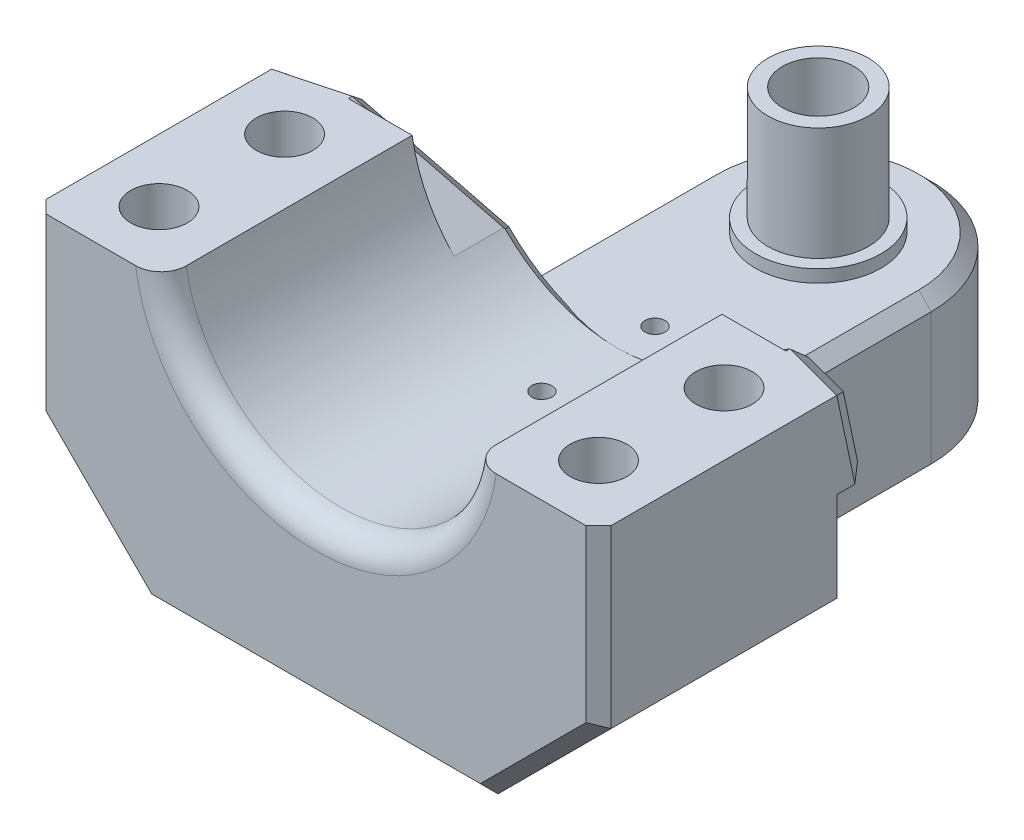
from build123d import *

# Parameters (mm, degrees)
SKETCH1_R               = 2.25
SKETCH1_R_2             = 2.75
BOSS_EXTRUDE1_DEPTH     = 23
CUT_EXTRUDE1_DEPTH      = 10
CUT_EXTRUDE1_DEPTH_BACK = 51.55937104
SKETCH2_R               = 12.5
BOSS_EXTRUDE2_START     = -22.5
BOSS_EXTRUDE2_DEPTH     = 5
CUT_EXTRUDE8_REACH      = 52.496
FILLET1_R               = 2
CHAMFER1_SIZE           = 9
CHAMFER2_SIZE           = 1
SKETCH5_R               = 3.35
CUT_EXTRUDE10_DEPTH     = 4
CUT_EXTRUDE11_START     = -15
SKETCH6_W               = 18
SKETCH6_H               = 3.825324214
CUT_EXTRUDE11_DEPTH     = 36.559371208
CHAMFER3_SIZE           = 1
CHAMFER4_SIZE           = 1
CHAMFER5_SIZE           = 1
CHAMFER6_SIZE           = 1
SKETCH7_R               = 4
SKETCH7_R_2             = 2.85
BOSS_EXTRUDE3_DEPTH     = 10
SKETCH8_R               = 5
SKETCH8_R_2             = 4
EXTRUDE_THIN1_DEPTH     = 1
SKETCH10_R              = 0.3
BOSS_EXTRUDE4_DEPTH     = 4
BOSS_EXTRUDE5_START     = 4
SKETCH11_R              = 2.5
SKETCH11_R_2            = 1.6
BOSS_EXTRUDE5_DEPTH     = 2
SKETCH13_R              = 1.6
SKETCH13_R_2            = 0.8
CUT_EXTRUDE13_DEPTH     = 7
BOSS_EXTRUDE6_START     = 2
BOSS_EXTRUDE6_DEPTH     = 2
CUT_EXTRUDE14_REACH     = 52.559
SKETCH13_2_R            = 0.8
CHAMFER8_SIZE           = 1
CHAMFER8_SIZE2          = 1.732050808
CHAMFER9_SIZE           = 1
CHAMFER9_SIZE2          = 1.732050808
CUT_EXTRUDE15_DEPTH     = 15


with BuildPart() as part:
    # Sketch1 → Boss-Extrude1 (new body)
    with BuildSketch(Plane(origin=(0, 0, 0), x_dir=(1, 0, 0), z_dir=(0, 1, 0))):
        with BuildLine():
            Line((-22.5, -10), (-22.5, 10))
            Line((-22.5, 10), (-9, 10))
            Line((-9, 10), (-9, 30))
            ThreePointArc((-9, 30), (0, 39), (9, 30))
            Line((9, 30), (9, 10))
            Line((9, 10), (22.5, 10))
            Line((22.5, 10), (22.5, -10))
            Line((22.5, -10), (-22.5, -10))
        make_face()
        with Locations(Location((-17.5, 5, 0), (0, 0, 270))):
            Circle(SKETCH1_R, mode=Mode.SUBTRACT)
        with Locations(Location((-17.5, -5, 0), (0, 0, 270))):
            Circle(SKETCH1_R, mode=Mode.SUBTRACT)
        with Locations(Location((17.5, 5, 0), (0, 0, 270))):
            Circle(SKETCH1_R, mode=Mode.SUBTRACT)
        with Locations(Location((17.5, -5, 0), (0, 0, 270))):
            Circle(SKETCH1_R, mode=Mode.SUBTRACT)
        with Locations(Location((0, 30, 0), (0, 0, 270))):
            Circle(SKETCH1_R_2, mode=Mode.SUBTRACT)
    extrude(amount=BOSS_EXTRUDE1_DEPTH)

    # Sketch2 → Cut-Extrude1 (cut, two sides: drawn at the far end of the back side and taken through both)
    with BuildSketch(Plane.XY.offset(-CUT_EXTRUDE1_DEPTH_BACK)):
        with Locations((0, 25)):
            Circle(SKETCH2_R)
    extrude(amount=CUT_EXTRUDE1_DEPTH + CUT_EXTRUDE1_DEPTH_BACK, mode=Mode.SUBTRACT)

    # Sketch3 → Boss-Extrude2 (add)
    with BuildSketch(Plane(origin=(0, 0, -32.5), x_dir=(-1, 0, 0), z_dir=(0, 0, -1)).offset(BOSS_EXTRUDE2_START)):
        Polygon((9, 16.325324214), (17.41948134, 23), (22.5, 23), (22.5, 16.146397564), (9, 5.444060985), align=None)
    boss_extrude2 = extrude(amount=BOSS_EXTRUDE2_DEPTH)

    # Mirror1: Boss-Extrude2 across plane
    add(boss_extrude2.mirror(Plane(origin=(0, 0, 0), x_dir=(0, 0, 1), z_dir=(1, 0, 0))))

    # Sketch4 → Cut-Extrude8 (cut, up to next)
    with BuildSketch(Plane(origin=(4.474031923, 5.643574234, 0), x_dir=(0.7836265295847679, -0.6212322127280048, 0), z_dir=(0.6212322127280048, 0.7836265295847679, 0)), mode=Mode.PRIVATE) as cut_extrude8_sk1:
        Polygon((-17.194456051, 15), (-31.919937808, 10), (-31.919937808, 15.796390808), (-17.194456051, 15.796390808), align=None)
    cut_extrude8_tool1 = extrude(cut_extrude8_sk1.sketch, amount=-CUT_EXTRUDE8_REACH, mode=Mode.PRIVATE) & part.part
    cut_extrude8 = cut_extrude8_tool1.solids().sort_by_distance((-16.228214, 22.055604, -13.832193))[0]
    add(cut_extrude8, mode=Mode.SUBTRACT)

    # Mirror2: Cut-Extrude8 across plane
    add(cut_extrude8.mirror(Plane(origin=(0, 0, 0), x_dir=(0, 0, 1), z_dir=(1, 0, 0))), mode=Mode.SUBTRACT)

    # Fillet1
    fillet1_edges = [part.edges().sort_by_distance(p)[0] for p in [
        (0, 12.5, 10),
    ]]
    fillet(fillet1_edges, radius=FILLET1_R)

    # Chamfer1
    # the kernel refuses this chamfer: 9 mm, written as the material it takes off along each edge
    with BuildSketch(Plane(origin=(22.5, 0, -33.145146892), x_dir=(-0.9996219169112966, -0.027495876610586365, 0), z_dir=(0, 0, 1))) as chamfer1_piece_1:
        Polygon((CHAMFER1_SIZE * 0.999621916911, -CHAMFER1_SIZE * 0.0274958766106), (-CHAMFER1_SIZE * 0.0274958766106, -CHAMFER1_SIZE * 0.999621916911), (0, 0), align=None)
    extrude(amount=66.290293783, mode=Mode.SUBTRACT)
    with BuildSketch(Plane(origin=(-22.5, 0, 33.145146892), x_dir=(-0.02749587661058639, 0.9996219169112966, 0), z_dir=(0, 0, -1))) as chamfer1_piece_2:
        Polygon((CHAMFER1_SIZE * 0.999621916911, CHAMFER1_SIZE * 0.0274958766106), (-CHAMFER1_SIZE * 0.0274958766106, CHAMFER1_SIZE * 0.999621916911), (0, 0), align=None)
    extrude(amount=66.290293783, mode=Mode.SUBTRACT)

    # Chamfer2
    chamfer2_edges = [part.edges().sort_by_distance(p)[0] for p in [
        (-11.25, 0, -10),
        (11.25, 0, -10),
        (18, 4.5, -10),
        (0, 0, 10),
        (-18, 4.5, 10),
        (18, 4.5, 10),
        (-18, 4.5, -10),
        (22.5, 16, 10),
        (-22.5, 16, 10),
        (-22.5, 12.573198782, -10),
        (22.5, 12.573198782, -10),
        (-9, 0, -20),
        (0, 0, -39),
        (9, 0, -20),
    ]]
    chamfer(chamfer2_edges, length=CHAMFER2_SIZE)

    # Sketch5 → Cut-Extrude10 (cut)
    with BuildSketch(Plane(origin=(0, 0, 0), x_dir=(1, 0, 0), z_dir=(0, 1, 0))):
        with Locations(Location((0, 30, 0), (0, 0, 270))):
            Circle(SKETCH5_R)
    extrude(amount=CUT_EXTRUDE10_DEPTH, mode=Mode.SUBTRACT)

    # Sketch6 → Cut-Extrude11 (cut, through all)
    with BuildSketch(Plane.XY.offset(CUT_EXTRUDE11_START)):
        with Locations((0, 14.412662107)):
            Rectangle(SKETCH6_W, SKETCH6_H)
    extrude(amount=-CUT_EXTRUDE11_DEPTH, mode=Mode.SUBTRACT)

    # Chamfer3
    chamfer3_edges = [part.edges().sort_by_distance(p)[0] for p in [
        (0, 12.5, -39),
        (9, 12.5, -22.5),
        (-9, 12.5, -22.5),
    ]]
    chamfer(chamfer3_edges, length=CHAMFER3_SIZE)

    # Chamfer4
    # the kernel refuses this chamfer: 1 mm, written as the material it takes off along each edge
    with BuildSketch(Plane(origin=(0, 25, -15), x_dir=(0, -1, 0), z_dir=(1, 0, 0))) as chamfer4_piece_1_section:
        Polygon((12.5 + CHAMFER4_SIZE, 0), (12.5, -CHAMFER4_SIZE), (12.5, 0), align=None)
    chamfer4_piece_1 = revolve(axis=Axis((0, 25, -15), (0, 0, -1)), revolution_arc=57.843446633, mode=Mode.PRIVATE)
    chamfer4_piece_1 = split(chamfer4_piece_1, bisect_by=Plane(origin=(-3.818564671, 12.5, -14.588370219), z_dir=(0, 1, 0)), keep=Keep.TOP, mode=Mode.PRIVATE)
    add(chamfer4_piece_1, mode=Mode.SUBTRACT)
    with BuildSketch(Plane(origin=(0, 25, -15), x_dir=(0.8465969958559083, -0.5322344658209869, 0), z_dir=(0.5322344658209869, 0.8465969958559083, 0))) as chamfer4_piece_2_section:
        Polygon((12.5, -CHAMFER4_SIZE), (12.5 + CHAMFER4_SIZE, 0), (12.5, 0), align=None)
    chamfer4_piece_2 = revolve(axis=Axis((0, 25, -15), (0, 0, -1)), revolution_arc=57.843446633, mode=Mode.PRIVATE)
    chamfer4_piece_2 = split(chamfer4_piece_2, bisect_by=Plane(origin=(7.537884287, 12.5, -14.673877281), z_dir=(0, 1, 0)), keep=Keep.TOP, mode=Mode.PRIVATE)
    add(chamfer4_piece_2, mode=Mode.SUBTRACT)

    # Chamfer5
    chamfer5_edges = [part.edges().sort_by_distance(p)[0] for p in [
        (-11.648575872, 7.543761018, -15),
        (-18.398575872, 12.894929307, -13.222841989),
        (-13.931019885, 20.234467509, -12.863375935),
        (18.398575872, 12.894929307, -13.222841989),
        (11.648575872, 7.543761018, -15),
        (13.931019885, 20.234467509, -12.863375935),
    ]]
    chamfer(chamfer5_edges, length=CHAMFER5_SIZE)

    # Chamfer6
    chamfer6_edges = [part.edges().sort_by_distance(p)[0] for p in [
        (20.764592688, 23, -10.461754404),
        (-22.5, 20.211257833, -10.588251201),
        (22.5, 20.211257833, -10.588251201),
        (-20.764592688, 23, -10.461754404),
    ]]
    chamfer(chamfer6_edges, length=CHAMFER6_SIZE)

    # Sketch7 → Boss-Extrude3 (add)
    with BuildSketch(Plane(origin=(0, 12.5, 0), x_dir=(1, 0, 0), z_dir=(0, 1, 0))):
        with Locations((0, 30)):
            Circle(SKETCH7_R)
        with Locations(Location((0, 30, 0), (0, 0, 180))):
            Circle(SKETCH7_R_2, mode=Mode.SUBTRACT)
    extrude(amount=BOSS_EXTRUDE3_DEPTH)

    # Sketch8 → Extrude-Thin1 (add)
    with BuildSketch(Plane(origin=(0, 12.5, 0), x_dir=(1, 0, 0), z_dir=(0, 1, 0))):
        with Locations((0, 30)):
            Circle(SKETCH8_R)
        with Locations((0, 30)):
            Circle(SKETCH8_R_2, mode=Mode.SUBTRACT)
    extrude(amount=EXTRUDE_THIN1_DEPTH)

    # Sketch10 → Boss-Extrude4 (add)
    with BuildSketch(Plane(origin=(0, 0, 0), x_dir=(1, 0, 0), z_dir=(0, 1, 0))):
        with Locations((0.219852061, 26.8)):
            Circle(SKETCH10_R)
        with Locations((-0.582862634, 26.8458589)):
            Circle(SKETCH10_R)
        with Locations((-1.348953927, 27.089904086)):
            Circle(SKETCH10_R)
        with Locations((-2.030285484, 27.5168013)):
            Circle(SKETCH10_R)
        with Locations((-2.584046736, 28.099727021)):
            Circle(SKETCH10_R)
        with Locations((-2.975442829, 28.802053882)):
            Circle(SKETCH10_R)
        with Locations((-3.179880906, 29.579652104)):
            Circle(SKETCH10_R)
        with Locations((-3.184515371, 30.38366233)):
            Circle(SKETCH10_R)
        with Locations((-2.989055023, 31.16356564)):
            Circle(SKETCH10_R)
        with Locations((-2.605781355, 31.870357842)):
            Circle(SKETCH10_R)
        with Locations((-2.058776861, 32.459628583)):
            Circle(SKETCH10_R)
        with Locations((-1.382411846, 32.894351813)):
            Circle(SKETCH10_R)
        with Locations((-0.61918481, 33.147212274)):
            Circle(SKETCH10_R)
        with Locations((0.182947885, 33.202321814)):
            Circle(SKETCH10_R)
        with Locations((0.973585292, 33.056217697)):
            Circle(SKETCH10_R)
        with Locations((1.703048753, 32.718080181)):
            Circle(SKETCH10_R)
        with Locations((2.325503399, 32.209155692)):
            Circle(SKETCH10_R)
        with Locations((2.801838113, 31.561421826)):
            Circle(SKETCH10_R)
        with Locations((3.102123034, 30.815578084)):
            Circle(SKETCH10_R)
        with Locations((3.207490156, 30.018488571)):
            Circle(SKETCH10_R)
        with Locations((3.111318875, 29.220237354)):
            Circle(SKETCH10_R)
        with Locations((2.819651987, 28.470981491)):
            Circle(SKETCH10_R)
        with Locations((2.350815994, 27.817799485)):
            Circle(SKETCH10_R)
        with Locations((1.734269587, 27.301733162)):
            Circle(SKETCH10_R)
        with Locations((1.008752644, 26.955208869)):
            Circle(SKETCH10_R)
    extrude(amount=BOSS_EXTRUDE4_DEPTH)


with BuildPart() as body_2:
    # Sketch11 → Boss-Extrude5 (new body)
    with BuildSketch(Plane(origin=(0, 0, 0), x_dir=(1, 0, 0), z_dir=(0, 1, 0)).offset(BOSS_EXTRUDE5_START)):
        with Locations(Location((0, 30, 0), (0, 0, 270))):
            Circle(SKETCH11_R)
        with Locations(Location((0, 30, 0), (0, 0, 270))):
            Circle(SKETCH11_R_2, mode=Mode.SUBTRACT)
    extrude(amount=BOSS_EXTRUDE5_DEPTH)


with BuildPart() as cut_extrude13_tool:
    # Sketch13 → Cut-Extrude13 (new body)
    with BuildSketch(Plane(origin=(0, 0, 0), x_dir=(1, 0, 0), z_dir=(0, 1, 0))):
        with BuildLine():
            Line((-4, 7.2), (-7.7, 30))
            ThreePointArc((-7.7, 30), (0, 37.7), (7.7, 30))
            Line((7.7, 30), (4, 7.2))
            ThreePointArc((4, 7.2), (0, 3.2), (-4, 7.2))
        make_face()
        with Locations((0, 30)):
            Circle(SKETCH13_R, mode=Mode.SUBTRACT)
        with Locations(Location((0, 17, 0), (0, 0, 270))):
            Circle(SKETCH13_R_2, mode=Mode.SUBTRACT)
        with Locations(Location((0, 8, 0), (0, 0, 270))):
            Circle(SKETCH13_R_2, mode=Mode.SUBTRACT)
    extrude(amount=CUT_EXTRUDE13_DEPTH)


with BuildPart() as part_1:
    add(part.part)

    # Cut-Extrude13: cut by cut_extrude13_tool
    add(cut_extrude13_tool.part, mode=Mode.SUBTRACT)

    # Sketch14 → Boss-Extrude6 (add)
    with BuildSketch(Plane(origin=(0, 7, 0), x_dir=(-1, 0, 0), z_dir=(0, -1, 0)).offset(BOSS_EXTRUDE6_START)):
        with BuildLine():
            Line((-6.401754386, 22), (6.401754386, 22))
            Line((6.401754386, 22), (4, 7.2))
            ThreePointArc((4, 7.2), (0, 3.2), (-4, 7.2))
            Line((-4, 7.2), (-6.401754386, 22))
        make_face()
    extrude(amount=-BOSS_EXTRUDE6_DEPTH)

    # Sketch13<2> → Cut-Extrude14 (cut, up to next)
    with BuildSketch(Plane(origin=(0, 0, 0), x_dir=(1, 0, 0), z_dir=(0, 1, 0)), mode=Mode.PRIVATE) as cut_extrude14_sk1:
        with Locations(Location((0, 17, 0), (0, 0, 90))):
            Circle(SKETCH13_2_R)
    cut_extrude14_tool1 = extrude(cut_extrude14_sk1.sketch, amount=CUT_EXTRUDE14_REACH, mode=Mode.PRIVATE) & part_1.part
    # Sketch13<2> → Cut-Extrude14 (cut, up to next)
    with BuildSketch(Plane(origin=(0, 0, 0), x_dir=(1, 0, 0), z_dir=(0, 1, 0)), mode=Mode.PRIVATE) as cut_extrude14_sk2:
        with Locations(Location((0, 8, 0), (0, 0, 90))):
            Circle(SKETCH13_2_R)
    cut_extrude14_tool2 = extrude(cut_extrude14_sk2.sketch, amount=CUT_EXTRUDE14_REACH, mode=Mode.PRIVATE) & part_1.part
    add(cut_extrude14_tool1.solids().sort_by_distance((0, 0, -17))[0], mode=Mode.SUBTRACT)
    add(cut_extrude14_tool2.solids().sort_by_distance((0, 0, -8))[0], mode=Mode.SUBTRACT)

    # Chamfer8
    chamfer8_edges = [part_1.edges().sort_by_distance(p)[0] for p in [
        (0, 7, -22),
    ]]
    chamfer8_side = [part_1.faces().sort_by_distance(p)[0] for p in [
        (0, 7, -22.21992044),
    ]]
    chamfer(chamfer8_edges, length=CHAMFER8_SIZE, length2=CHAMFER8_SIZE2, reference=chamfer8_side[0])

    # Chamfer9
    chamfer9_edges = [part_1.edges().sort_by_distance(p)[0] for p in [
        (0, 7, -32.75),
    ]]
    chamfer9_side = [part_1.faces().sort_by_distance(p)[0] for p in [
        (0, 9.75, -32.75),
    ]]
    chamfer(chamfer9_edges, length=CHAMFER9_SIZE, length2=CHAMFER9_SIZE2, reference=chamfer9_side[0])

    # Sketch15 → Cut-Extrude15 (cut)
    with BuildSketch(Plane(origin=(0, 0, 0), x_dir=(1, 0, 0), z_dir=(0, 1, 0))):
        Polygon((-17.5, 9.099186911), (-21.05, 7.049593456), (-21.05, 2.950406544), (-17.5, 0.900813089), (-13.95, 2.950406544), (-13.95, 7.049593456), align=None)
        Polygon((-17.5, -0.900813089), (-21.05, -2.950406544), (-21.05, -7.049593456), (-17.5, -9.099186911), (-13.95, -7.049593456), (-13.95, -2.950406544), align=None)
        Polygon((17.5, 9.099186911), (13.95, 7.049593456), (13.95, 2.950406544), (17.5, 0.900813089), (21.05, 2.950406544), (21.05, 7.049593456), align=None)
        Polygon((17.5, -0.900813089), (13.95, -2.950406544), (13.95, -7.049593456), (17.5, -9.099186911), (21.05, -7.049593456), (21.05, -2.950406544), align=None)
    extrude(amount=CUT_EXTRUDE15_DEPTH, mode=Mode.SUBTRACT)


with BuildPart() as body_2_1:
    add(body_2.part)

    # Cut-Extrude13: cut by cut_extrude13_tool
    add(cut_extrude13_tool.part, mode=Mode.SUBTRACT)


solid = part_1.part
